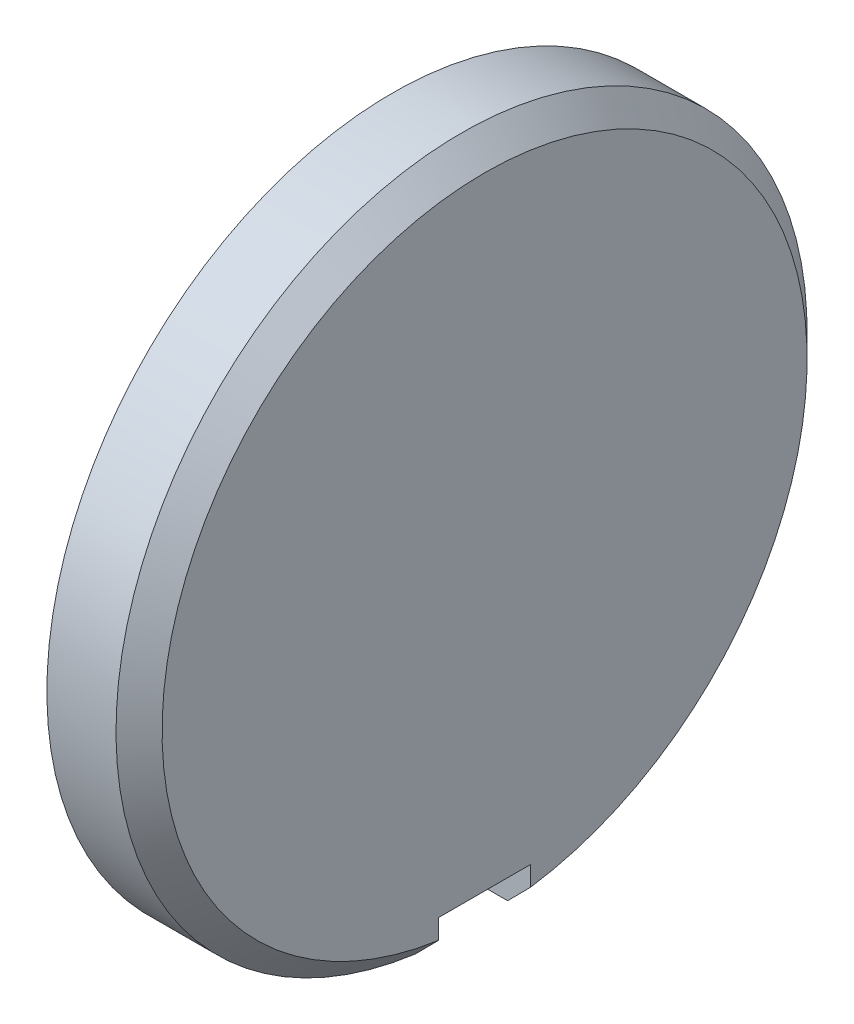
from build123d import *

# Parameters (mm, degrees)
BOSS_EXTRUDE1_START = -55.2
SKETCH2_W           = 1.28
SKETCH2_H           = 0.8
BOSS_EXTRUDE1_DEPTH = 6.4
BOSS_EXTRUDE2_START = -52.4
SKETCH3_W           = 1.28
SKETCH3_H           = 6.4
BOSS_EXTRUDE2_DEPTH = 0.8
BOSS_EXTRUDE3_START = -52.8
SKETCH4_W           = 1.8
SKETCH4_H           = 0.9
BOSS_EXTRUDE3_DEPTH = 1.6


with BuildPart() as part:
    # Sketch1 → Revolve1 (revolve)
    with BuildSketch(Plane.XY.offset(-52)):
        Polygon((74, -17.7), (75.2, -17.7), (75.2, -20), (76.8, -20), (76.8, -14.4), (76.4, -14), (75.2, -14), (75.2, -17), (74, -17), align=None)
    revolve(axis=Axis((69, -20, -52), (1, 0, 0)))


with BuildPart() as body_2:
    # Sketch2 → Boss-Extrude1 (new body)
    with BuildSketch(Plane.XY.offset(BOSS_EXTRUDE1_START)):
        with Locations((74.54, -20)):
            Rectangle(SKETCH2_W, SKETCH2_H)
    extrude(amount=BOSS_EXTRUDE1_DEPTH)


with BuildPart() as part_1:
    add(part.part)

    # Combine1: cut body 2
    add(body_2.part, mode=Mode.SUBTRACT)


with BuildPart() as body_2_2:
    # Sketch3 → Boss-Extrude2 (new body)
    with BuildSketch(Plane.XY.offset(BOSS_EXTRUDE2_START)):
        with Locations((74.54, -20)):
            Rectangle(SKETCH3_W, SKETCH3_H)
    extrude(amount=BOSS_EXTRUDE2_DEPTH)


with BuildPart() as part_2:
    add(part_1.part)

    # Combine2: cut body 2 2
    add(body_2_2.part, mode=Mode.SUBTRACT)


with BuildPart() as body_2_3:
    # Sketch4 → Boss-Extrude3 (new body)
    with BuildSketch(Plane.XY.offset(BOSS_EXTRUDE3_START)):
        with Locations((76, -25.65)):
            Rectangle(SKETCH4_W, SKETCH4_H)
    extrude(amount=BOSS_EXTRUDE3_DEPTH)


with BuildPart() as part_3:
    add(part_2.part)

    # Combine3: cut body 2 3
    add(body_2_3.part, mode=Mode.SUBTRACT)


solid = part_3.part
